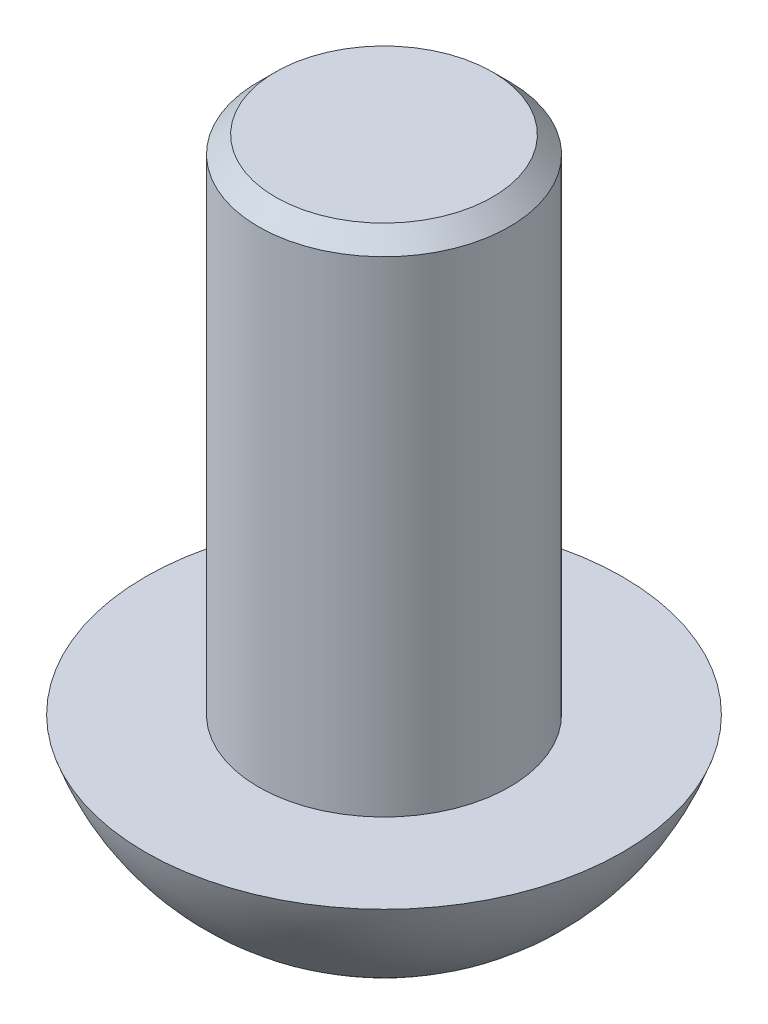
from build123d import *

# Parameters (mm, degrees)
CUT_EXTRUDE_1_REACH = 16.411


with BuildPart() as part:
    # 草图1 → 旋转2 (revolve)
    with BuildSketch(Plane.XY):
        with BuildLine():
            Line((4.75, 0), (2.5, 0))
            Line((2.5, 0), (2.5, 9.66))
            Line((2.5, 9.66), (2.16, 10))
            Line((2.16, 10), (0, 10))
            Line((0, 10), (0, 0))
            Line((0, 0), (1.5, -0.75))
            Line((1.5, -0.75), (1.5, -2.75))
            Line((1.5, -2.75), (2.5, -2.75))
            ThreePointArc((2.5, -2.75), (3.877015605, -1.581194586), (4.75, 0))
        make_face()
    revolve(axis=Axis((0, 0, 0), (0, 1, 0)))

    # 切除-拉伸1: up to this cone (the profile starts inside it)
    cut_extrude_1_end = Plane(origin=(0, -2.75, 0), z_dir=(0, -1, 0)).offset(-2.749999) * Cone(2e-06, 50.322, 25.160999, align=(Align.CENTER, Align.CENTER, Align.MIN), mode=Mode.PRIVATE)
    # 草图2 → 切除-拉伸1 (cut, up to the surface)
    with BuildSketch(Plane.XZ.offset(2.75), mode=Mode.PRIVATE) as cut_extrude_1_sk1:
        Polygon((1.732050808, 0), (0.866025404, 1.5), (-0.866025404, 1.5), (-1.732050808, 0), (-0.866025404, -1.5), (0.866025404, -1.5), align=None)
    cut_extrude_1_tool1 = extrude(cut_extrude_1_sk1.sketch, amount=-CUT_EXTRUDE_1_REACH, mode=Mode.PRIVATE) & cut_extrude_1_end
    add(cut_extrude_1_tool1.solids().sort_by_distance((0, -2.75, 0))[0], mode=Mode.SUBTRACT)


solid = part.part
